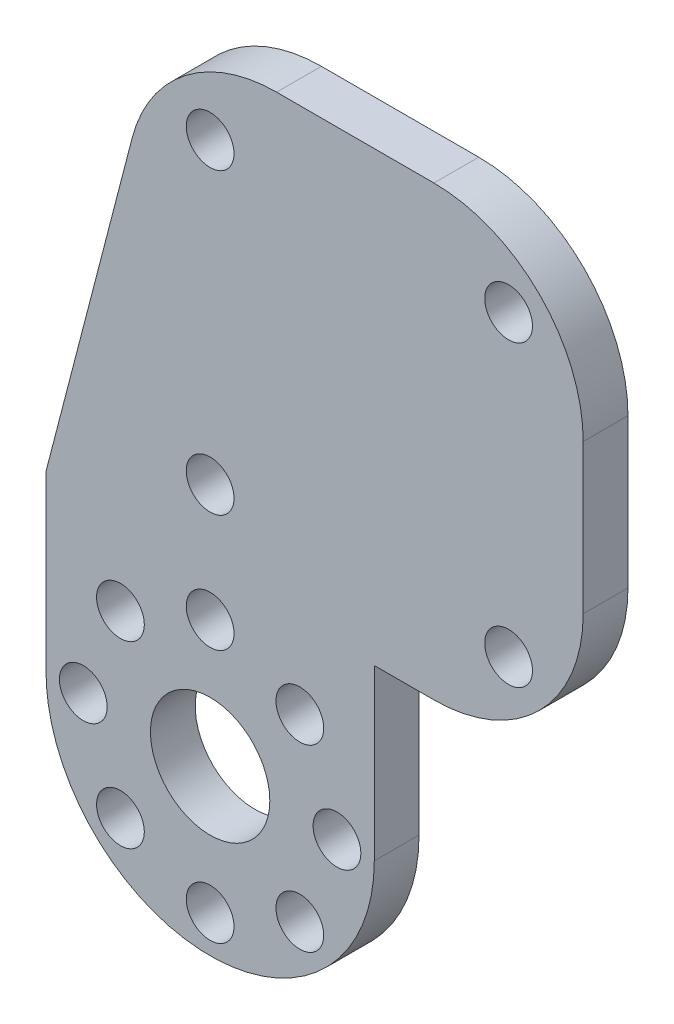
from build123d import *

# Parameters (mm, degrees)
SKETCH_1_R      = 1.6
SKETCH_1_R_2    = 4
EXTRUDE_1_DEPTH = 3


with BuildPart() as part:
    # Sketch 1 → 填料-伸長1 (new body)
    with BuildSketch(Plane.XY):
        with BuildLine():
            Line((-5.221972445, 17.513309351), (-10.996349884, -4.724410549))
            Line((-10.996349884, -4.724410549), (-10.996349884, -16.06664646))
            ThreePointArc((-10.996349884, -16.06664646), (-0.137806793, -27.349136752), (10.99999726, -16.342235911))
            Line((10.99999726, -16.342235911), (10.99999726, -5))
            Line((10.99999726, -5), (15, -5))
            ThreePointArc((15, -5), (22.071067812, -2.071067812), (25, 5))
            Line((25, 5), (25, 15))
            ThreePointArc((25, 15), (22.071067812, 22.071067812), (15, 25))
            Line((15, 25), (4.4570397, 25))
            ThreePointArc((4.4570397, 25), (-1.661248724, 22.909901817), (-5.221972445, 17.513309351))
        make_face()
        with Locations((20, 20)):
            Circle(SKETCH_1_R, mode=Mode.SUBTRACT)
        with Locations((0, 20)):
            Circle(SKETCH_1_R, mode=Mode.SUBTRACT)
        Circle(SKETCH_1_R, mode=Mode.SUBTRACT)
        with Locations((20, 0)):
            Circle(SKETCH_1_R, mode=Mode.SUBTRACT)
        with Locations((0, -16.35)):
            Circle(SKETCH_1_R_2, mode=Mode.SUBTRACT)
        with Locations((8.5, -16.35)):
            Circle(SKETCH_1_R, mode=Mode.SUBTRACT)
        with Locations((6.01040764, -22.36040764)):
            Circle(SKETCH_1_R, mode=Mode.SUBTRACT)
        with Locations((0, -24.85)):
            Circle(SKETCH_1_R, mode=Mode.SUBTRACT)
        with Locations((-6.01040764, -22.36040764)):
            Circle(SKETCH_1_R, mode=Mode.SUBTRACT)
        with Locations((-8.5, -16.35)):
            Circle(SKETCH_1_R, mode=Mode.SUBTRACT)
        with Locations((-6.01040764, -10.33959236)):
            Circle(SKETCH_1_R, mode=Mode.SUBTRACT)
        with Locations((0, -7.85)):
            Circle(SKETCH_1_R, mode=Mode.SUBTRACT)
        with Locations((6.01040764, -10.33959236)):
            Circle(SKETCH_1_R, mode=Mode.SUBTRACT)
    extrude(amount=EXTRUDE_1_DEPTH)


solid = part.part
